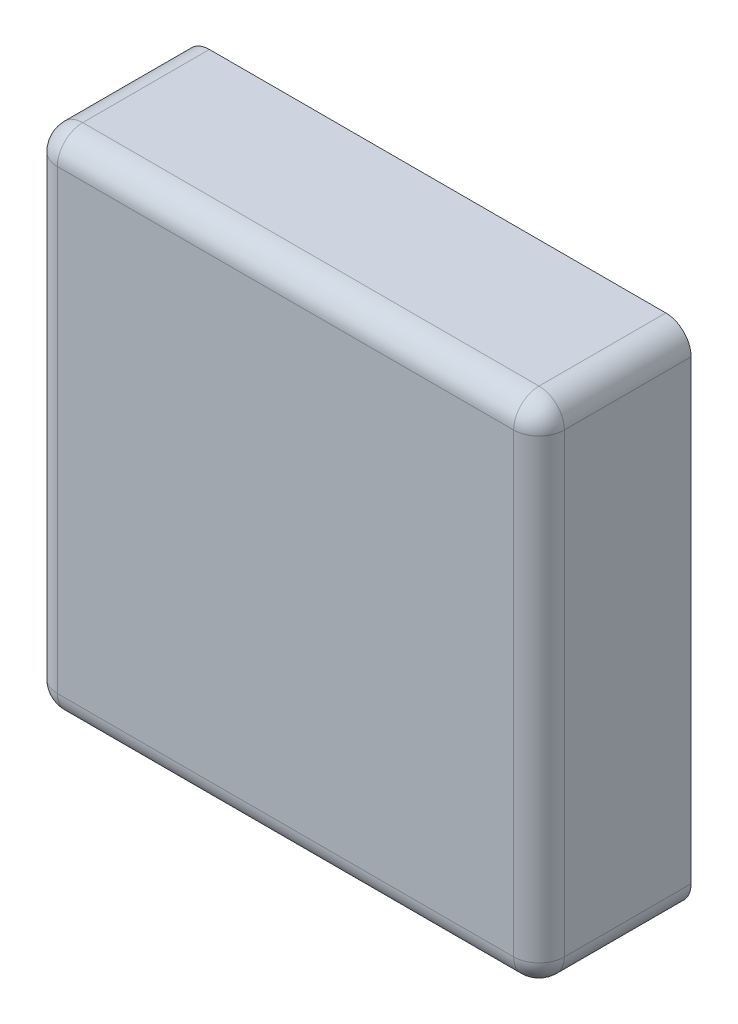
from build123d import *

# Parameters (mm, degrees)
SKETCH1_W           = 100
SKETCH1_H           = 100
BOSS_EXTRUDE1_DEPTH = 30
FILLET1_R           = 5


with BuildPart() as part:
    # Sketch1 → Boss-Extrude1 (new body)
    with BuildSketch(Plane.XY):
        with Locations((-25.636160714, -1.986607143)):
            Rectangle(SKETCH1_W, SKETCH1_H)
    extrude(amount=BOSS_EXTRUDE1_DEPTH)

    # Fillet1
    fillet1_edges = [part.edges().sort_by_distance(p)[0] for p in [
        (-75.636160714, -51.986607143, 15),
        (24.363839286, -51.986607143, 15),
        (-25.636160714, -51.986607143, 30),
        (24.363839286, -1.986607143, 30),
        (24.363839286, 48.013392857, 15),
        (-75.636160714, -1.986607143, 30),
        (-75.636160714, 48.013392857, 15),
        (-25.636160714, 48.013392857, 30),
    ]]
    fillet(fillet1_edges, radius=FILLET1_R)


solid = part.part
